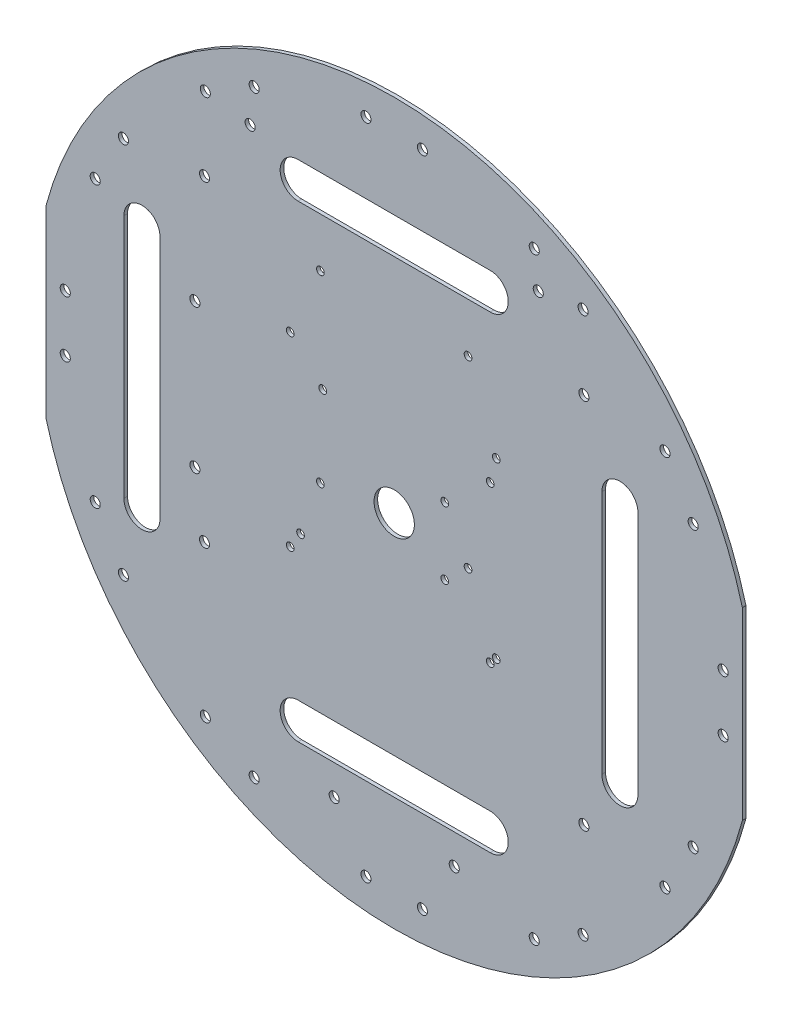
from build123d import *

# Parameters (mm, degrees)
SM_BASE_FLANGE_1_OUTLINE_R   = 2.1
SM_BASE_FLANGE_1_OUTLINE_R_2 = 1.6
SM_BASE_FLANGE_1_OUTLINE_R_3 = 8.4
SM_BASE_FLANGE_1_DEPTH       = 1.5
SKETCH_2_R                   = 1.6
CUT_EXTRUDE_1_DEPTH          = 10
SKETCH_4_R                   = 2.1
CUT_EXTRUDE_2_DEPTH          = 1.5
SKETCH_6_R                   = 1.6
CUT_EXTRUDE_4_DEPTH          = 1.5


# Read off the part's stored shape, not the designer's step: 基体-法兰1
with BuildPart() as part:
    # 基体-法兰1 outline → 基体-法兰1 (new body)
    with BuildSketch(Plane.XY):
        with BuildLine():
            ThreePointArc((-145, -38.405728739), (0, -150), (145, -38.405728739))
            Line((145, -38.405728739), (145, 38.405728739))
            ThreePointArc((145, 38.405728739), (0, 150), (-145, 38.405728739))
            Line((-145, 38.405728739), (-145, -38.405728739))
        make_face()
        with Locations((-78.675798494, -112.770480318)):
            Circle(SM_BASE_FLANGE_1_OUTLINE_R, mode=Mode.SUBTRACT)
        with Locations((-112.770480318, -78.675798494)):
            Circle(SM_BASE_FLANGE_1_OUTLINE_R, mode=Mode.SUBTRACT)
        with Locations((-58.324201506, -124.520480318)):
            Circle(SM_BASE_FLANGE_1_OUTLINE_R, mode=Mode.SUBTRACT)
        with Locations((-11.75, -137)):
            Circle(SM_BASE_FLANGE_1_OUTLINE_R, mode=Mode.SUBTRACT)
        with Locations((-25, -115)):
            Circle(SM_BASE_FLANGE_1_OUTLINE_R, mode=Mode.SUBTRACT)
        with Locations((-124.520480318, -58.324201506)):
            Circle(SM_BASE_FLANGE_1_OUTLINE_R, mode=Mode.SUBTRACT)
        with Locations((-79, -49.959487412)):
            Circle(SM_BASE_FLANGE_1_OUTLINE_R, mode=Mode.SUBTRACT)
        with Locations((-137, -11.75)):
            Circle(SM_BASE_FLANGE_1_OUTLINE_R, mode=Mode.SUBTRACT)
        with Locations((-83, -25)):
            Circle(SM_BASE_FLANGE_1_OUTLINE_R, mode=Mode.SUBTRACT)
        with Locations((-30.75, -4.524131076)):
            Circle(SM_BASE_FLANGE_1_OUTLINE_R_2, mode=Mode.SUBTRACT)
        with Locations((11.75, -137)):
            Circle(SM_BASE_FLANGE_1_OUTLINE_R, mode=Mode.SUBTRACT)
        with Locations((25, -115)):
            Circle(SM_BASE_FLANGE_1_OUTLINE_R, mode=Mode.SUBTRACT)
        with Locations((58.324201506, -124.520480318)):
            Circle(SM_BASE_FLANGE_1_OUTLINE_R, mode=Mode.SUBTRACT)
        with BuildLine():
            Line((40, -102.5), (-40, -102.5))
            ThreePointArc((-40, -102.5), (-47.5, -95), (-40, -87.5))
            Line((-40, -87.5), (40, -87.5))
            ThreePointArc((40, -87.5), (47.5, -95), (40, -102.5))
        make_face(mode=Mode.SUBTRACT)
        with Locations((78.675798494, -112.770480318)):
            Circle(SM_BASE_FLANGE_1_OUTLINE_R, mode=Mode.SUBTRACT)
        with Locations((112.770480318, -78.675798494)):
            Circle(SM_BASE_FLANGE_1_OUTLINE_R, mode=Mode.SUBTRACT)
        with Locations((30.75, -4.524131076)):
            Circle(SM_BASE_FLANGE_1_OUTLINE_R_2, mode=Mode.SUBTRACT)
        with Locations((79, -72.959487412)):
            Circle(SM_BASE_FLANGE_1_OUTLINE_R, mode=Mode.SUBTRACT)
        with Locations((124.520480318, -58.324201506)):
            Circle(SM_BASE_FLANGE_1_OUTLINE_R, mode=Mode.SUBTRACT)
        with Locations((137, -11.75)):
            Circle(SM_BASE_FLANGE_1_OUTLINE_R, mode=Mode.SUBTRACT)
        with Locations((-137, 11.75)):
            Circle(SM_BASE_FLANGE_1_OUTLINE_R, mode=Mode.SUBTRACT)
        with BuildLine():
            Line((-112.567715637, -50.975868924), (-112.567715637, 50.975868924))
            ThreePointArc((-112.567715637, 50.975868924), (-105.067715637, 58.475868924), (-97.567715637, 50.975868924))
            Line((-97.567715637, 50.975868924), (-97.567715637, -50.975868924))
            ThreePointArc((-97.567715637, -50.975868924), (-105.067715637, -58.475868924), (-112.567715637, -50.975868924))
        make_face(mode=Mode.SUBTRACT)
        with Locations((-83, 35)):
            Circle(SM_BASE_FLANGE_1_OUTLINE_R, mode=Mode.SUBTRACT)
        with Locations((-124.520480318, 58.324201506)):
            Circle(SM_BASE_FLANGE_1_OUTLINE_R, mode=Mode.SUBTRACT)
        with Locations((-30.75, 71.975868924)):
            Circle(SM_BASE_FLANGE_1_OUTLINE_R_2, mode=Mode.SUBTRACT)
        with Locations((-112.770480318, 78.675798494)):
            Circle(SM_BASE_FLANGE_1_OUTLINE_R, mode=Mode.SUBTRACT)
        with Locations((-79, 82.040512588)):
            Circle(SM_BASE_FLANGE_1_OUTLINE_R, mode=Mode.SUBTRACT)
        with Locations((-78.675798494, 112.770480318)):
            Circle(SM_BASE_FLANGE_1_OUTLINE_R, mode=Mode.SUBTRACT)
        with Locations((-58.324201506, 124.520480318)):
            Circle(SM_BASE_FLANGE_1_OUTLINE_R, mode=Mode.SUBTRACT)
        with Locations((-11.75, 137)):
            Circle(SM_BASE_FLANGE_1_OUTLINE_R, mode=Mode.SUBTRACT)
        Circle(SM_BASE_FLANGE_1_OUTLINE_R_3, mode=Mode.SUBTRACT)
        with Locations((30.75, 71.975868924)):
            Circle(SM_BASE_FLANGE_1_OUTLINE_R_2, mode=Mode.SUBTRACT)
        with BuildLine():
            Line((86.5, -50.975868924), (86.5, 50.975868924))
            ThreePointArc((86.5, 50.975868924), (94, 58.475868924), (101.5, 50.975868924))
            Line((101.5, 50.975868924), (101.5, -50.975868924))
            ThreePointArc((101.5, -50.975868924), (94, -58.475868924), (86.5, -50.975868924))
        make_face(mode=Mode.SUBTRACT)
        with Locations((137, 11.75)):
            Circle(SM_BASE_FLANGE_1_OUTLINE_R, mode=Mode.SUBTRACT)
        with Locations((124.520480318, 58.324201506)):
            Circle(SM_BASE_FLANGE_1_OUTLINE_R, mode=Mode.SUBTRACT)
        with BuildLine():
            Line((40, 92.5), (-40, 92.5))
            ThreePointArc((-40, 92.5), (-47.5, 100), (-40, 107.5))
            Line((-40, 107.5), (40, 107.5))
            ThreePointArc((40, 107.5), (47.5, 100), (40, 92.5))
        make_face(mode=Mode.SUBTRACT)
        with Locations((11.75, 137)):
            Circle(SM_BASE_FLANGE_1_OUTLINE_R, mode=Mode.SUBTRACT)
        with Locations((58.324201506, 124.520480318)):
            Circle(SM_BASE_FLANGE_1_OUTLINE_R, mode=Mode.SUBTRACT)
        with Locations((79, 82.040512588)):
            Circle(SM_BASE_FLANGE_1_OUTLINE_R, mode=Mode.SUBTRACT)
        with Locations((112.770480318, 78.675798494)):
            Circle(SM_BASE_FLANGE_1_OUTLINE_R, mode=Mode.SUBTRACT)
        with Locations((78.675798494, 112.770480318)):
            Circle(SM_BASE_FLANGE_1_OUTLINE_R, mode=Mode.SUBTRACT)
    extrude(amount=SM_BASE_FLANGE_1_DEPTH)

    # 草图2 → 切除-拉伸1 (cut)
    with BuildSketch(Plane.XY.offset(1.5)):
        with Locations((40, -34)):
            Circle(SKETCH_2_R)
        with Locations((40, 31)):
            Circle(SKETCH_2_R)
        with Locations((21.043, -13.55)):
            Circle(SKETCH_2_R)
        with Locations((-39, -27)):
            Circle(SKETCH_2_R)
        with Locations((-29.75, 29.67)):
            Circle(SKETCH_2_R)
        with Locations((21.043, 14.45)):
            Circle(SKETCH_2_R)
    extrude(amount=-CUT_EXTRUDE_1_DEPTH, mode=Mode.SUBTRACT)

    # 草图4 → 切除-拉伸2 (cut)
    with BuildSketch(Plane(origin=(0, 0, 0), x_dir=(-1, 0, 0), z_dir=(0, 0, -1))):
        with Locations((-60, 110)):
            Circle(SKETCH_4_R)
        with Locations((60, 110)):
            Circle(SKETCH_4_R)
    extrude(amount=-CUT_EXTRUDE_2_DEPTH, mode=Mode.SUBTRACT)

    # 草图6 → 切除-拉伸4 (cut)
    with BuildSketch(Plane.XY.offset(1.5)):
        with Locations((42.500000131, 41)):
            Circle(SKETCH_6_R)
        with Locations((42.500001181, -31.28)):
            Circle(SKETCH_6_R)
        with Locations((-43.299998782, -33.8)):
            Circle(SKETCH_6_R)
        with Locations((-43.299999908, 43.65)):
            Circle(SKETCH_6_R)
    extrude(amount=-CUT_EXTRUDE_4_DEPTH, mode=Mode.SUBTRACT)


solid = part.part
